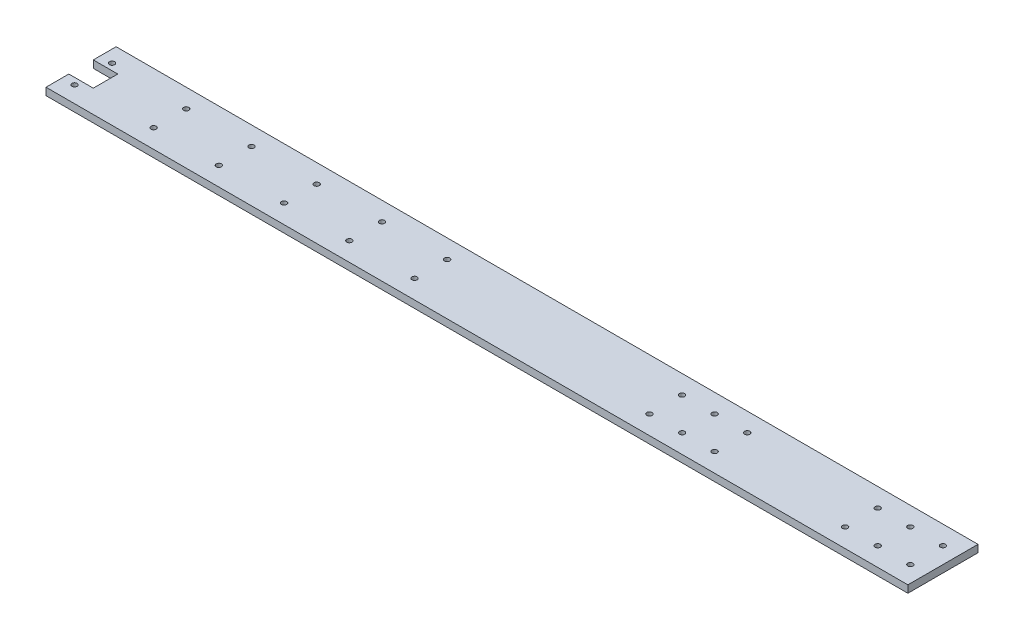
from build123d import *

# Parameters (mm, degrees)
SKETCH1_W           = 528.5
SKETCH1_H           = 43
SKETCH1_R           = 1.6
BOSS_EXTRUDE1_DEPTH = 4.5
SKETCH2_R           = 1.6
SKETCH2_W           = 15
SKETCH2_H           = 15
CUT_EXTRUDE1_DEPTH  = 266.161389535


with BuildPart() as part:
    # Sketch1 → Boss-Extrude1 (new body)
    with BuildSketch(Plane(origin=(0, 0, 0), x_dir=(1, 0, 0), z_dir=(0, 1, 0))):
        Rectangle(SKETCH1_W, SKETCH1_H)
        with Locations((-209.75, 10)):
            Circle(SKETCH1_R, mode=Mode.SUBTRACT)
        with Locations((-169.75, 10)):
            Circle(SKETCH1_R, mode=Mode.SUBTRACT)
        with Locations((-129.75, 10)):
            Circle(SKETCH1_R, mode=Mode.SUBTRACT)
        with Locations((-89.75, 10)):
            Circle(SKETCH1_R, mode=Mode.SUBTRACT)
        with Locations((-49.75, 10)):
            Circle(SKETCH1_R, mode=Mode.SUBTRACT)
        with Locations((-169.75, -10)):
            Circle(SKETCH1_R, mode=Mode.SUBTRACT)
        with Locations((-129.75, -10)):
            Circle(SKETCH1_R, mode=Mode.SUBTRACT)
        with Locations((-89.75, -10)):
            Circle(SKETCH1_R, mode=Mode.SUBTRACT)
        with Locations((-49.75, -10)):
            Circle(SKETCH1_R, mode=Mode.SUBTRACT)
        with Locations((-209.75, -10)):
            Circle(SKETCH1_R, mode=Mode.SUBTRACT)
        with Locations((234.25, 10)):
            Circle(SKETCH1_R, mode=Mode.SUBTRACT)
        with Locations((114.25, 10)):
            Circle(SKETCH1_R, mode=Mode.SUBTRACT)
        with Locations((114.25, -10)):
            Circle(SKETCH1_R, mode=Mode.SUBTRACT)
        with Locations((234.25, -10)):
            Circle(SKETCH1_R, mode=Mode.SUBTRACT)
        with Locations((134.25, -10)):
            Circle(SKETCH1_R, mode=Mode.SUBTRACT)
        with Locations((134.25, 10)):
            Circle(SKETCH1_R, mode=Mode.SUBTRACT)
        with Locations((254.25, 10)):
            Circle(SKETCH1_R, mode=Mode.SUBTRACT)
        with Locations((254.25, -10)):
            Circle(SKETCH1_R, mode=Mode.SUBTRACT)
        with Locations((94.25, -10)):
            Circle(SKETCH1_R, mode=Mode.SUBTRACT)
        with Locations((94.25, 10)):
            Circle(SKETCH1_R, mode=Mode.SUBTRACT)
        with Locations((214.25, 10)):
            Circle(SKETCH1_R, mode=Mode.SUBTRACT)
        with Locations((214.25, -10)):
            Circle(SKETCH1_R, mode=Mode.SUBTRACT)
    extrude(amount=BOSS_EXTRUDE1_DEPTH)

    # Sketch2 → Cut-Extrude1 (cut, through all)
    with BuildSketch(Plane(origin=(0, 4.5, 0), x_dir=(1, 0, 0), z_dir=(0, 1, 0))):
        with Locations((-256.75, 11.5)):
            Circle(SKETCH2_R)
        with Locations((-256.75, -11.5)):
            Circle(SKETCH2_R)
        with Locations((-256.75, 0)):
            Rectangle(SKETCH2_W, SKETCH2_H)
    extrude(amount=-CUT_EXTRUDE1_DEPTH, mode=Mode.SUBTRACT)


solid = part.part
